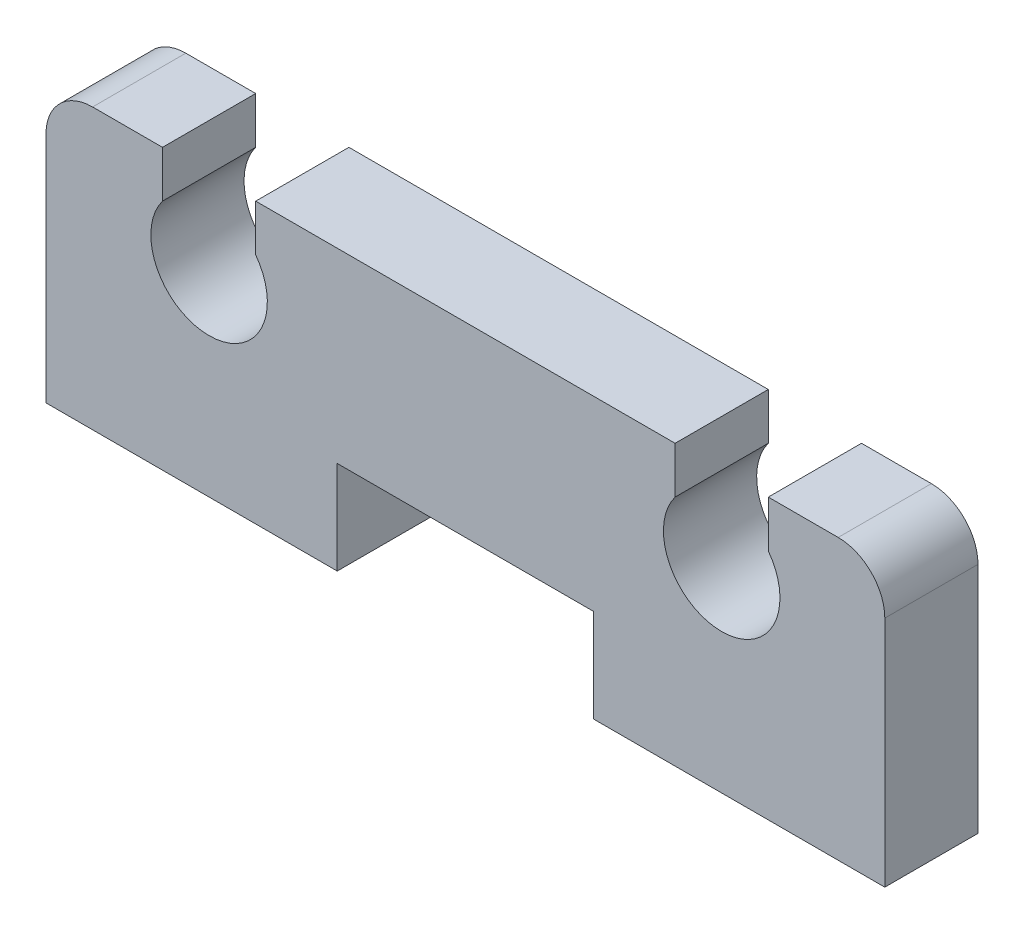
from build123d import *

# Parameters (mm, degrees)
TUBE_PLATE_BODY_DEPTH   = 2
TUBE_PLATE_CONTOURING_R = 1


with BuildPart() as part:
    # Sketch1 → Tube Plate Body (new body)
    with BuildSketch(Plane.XY):
        with BuildLine():
            Line((-9, 0), (-9, 6))
            Line((-9, 6), (-6.5, 6))
            Line((-6.5, 6), (-6.5, 5))
            ThreePointArc((-6.5, 5), (-5.5, 3), (-4.5, 5))
            Line((-4.5, 5), (-4.5, 6))
            Line((-4.5, 6), (4.5, 6))
            Line((4.5, 6), (4.5, 5))
            ThreePointArc((4.5, 5), (5.5, 3), (6.5, 5))
            Line((6.5, 5), (6.5, 6))
            Line((6.5, 6), (9, 6))
            Line((9, 6), (9, 0))
            Line((9, 0), (2.75, 0))
            Line((2.75, 0), (2.75, 2))
            Line((2.75, 2), (-2.75, 2))
            Line((-2.75, 2), (-2.75, 0))
            Line((-2.75, 0), (-9, 0))
        make_face()
    extrude(amount=TUBE_PLATE_BODY_DEPTH)

    # Tube Plate Contouring
    tube_plate_contouring_edges = [part.edges().sort_by_distance(p)[0] for p in [
        (9, 6, 1),
        (-9, 6, 1),
    ]]
    fillet(tube_plate_contouring_edges, radius=TUBE_PLATE_CONTOURING_R)


solid = part.part
